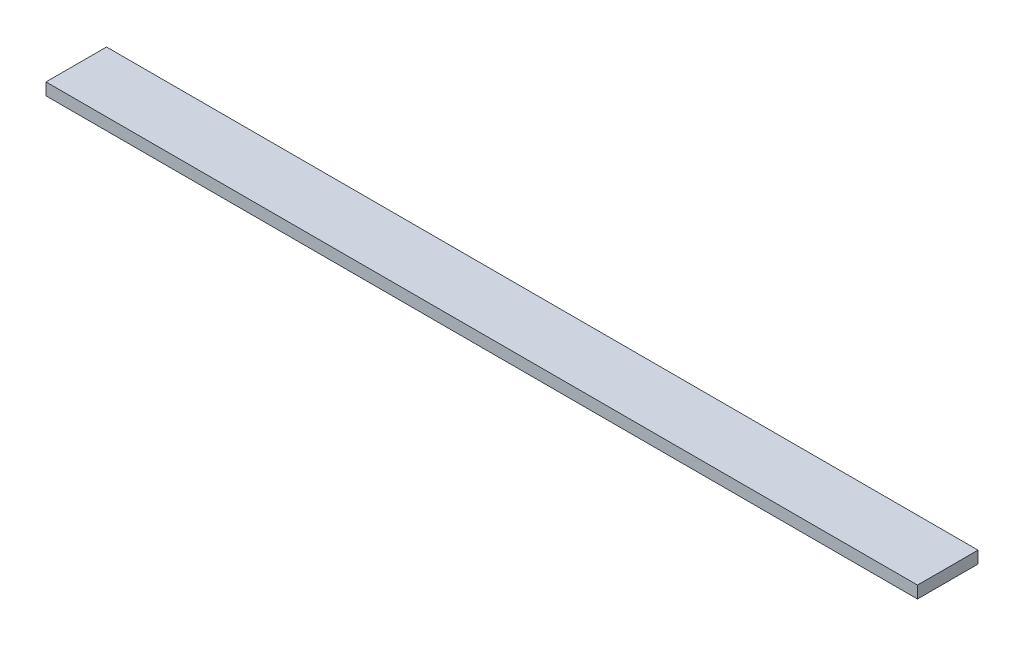
from build123d import *

# Parameters (mm, degrees)
SKETCH1_W           = 914.4
SKETCH1_H           = 63.5
BOSS_EXTRUDE1_DEPTH = 12.7


with BuildPart() as part:
    # Sketch1 → Boss-Extrude1 (new body)
    with BuildSketch(Plane(origin=(0, 0, 0), x_dir=(1, 0, 0), z_dir=(0, 1, 0))):
        with Locations((457.2, 31.75)):
            Rectangle(SKETCH1_W, SKETCH1_H)
    extrude(amount=BOSS_EXTRUDE1_DEPTH)


solid = part.part
